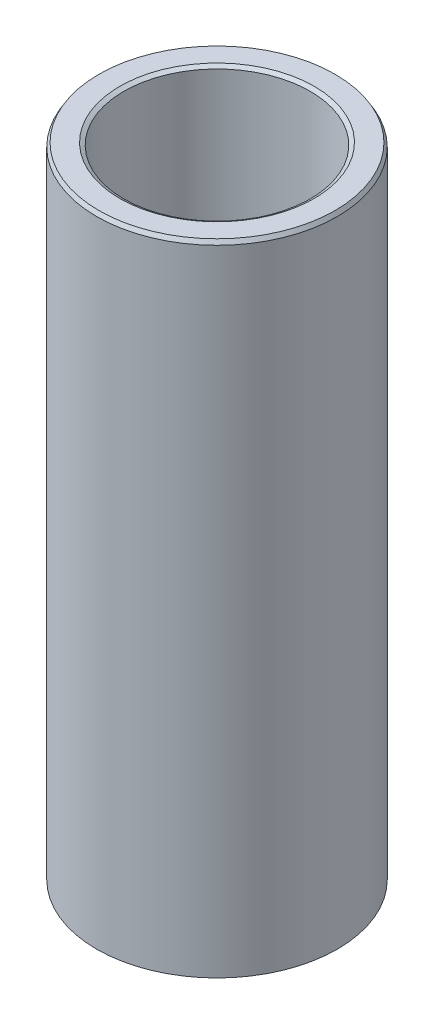
from build123d import *
from OCP.BRepFilletAPI import BRepFilletAPI_MakeChamfer

# Parameters (mm, degrees)
SKETCH1_R           = 15
BOSS_EXTRUDE1_DEPTH = 79.845970197
SKETCH2_R           = 11.615257821
CUT_EXTRUDE1_DEPTH  = 83.615851728
CHAMFER1_SIZE       = 0.49858104
CHAMFER1_SIZE2      = 0.290204487


with BuildPart() as part:
    # Sketch1 → Boss-Extrude1 (new body)
    with BuildSketch(Plane(origin=(0, 0, 0), x_dir=(1, 0, 0), z_dir=(0, 1, 0))):
        Circle(SKETCH1_R)
    extrude(amount=BOSS_EXTRUDE1_DEPTH)

    # Sketch2 → Cut-Extrude1 (cut, through all)
    with BuildSketch(Plane(origin=(0, 0, 0), x_dir=(1, 0, 0), z_dir=(0, 1, 0))):
        Circle(SKETCH2_R)
    extrude(amount=CUT_EXTRUDE1_DEPTH, mode=Mode.SUBTRACT)

    # Chamfer1: one chamfer whose edges measure the first distance from different faces: ONE call of the kernel's chamfer builder (chamfer() names one face for all edges)
    chamfer1_edges_1 = [part.edges().sort_by_distance(p)[0] for p in [
        (-11.615257821, 79.845970197, 0),
    ]]
    chamfer1_side_1 = [part.faces().sort_by_distance(p)[0] for p in [
        (-14.575735931, 79.845970197, 0),
    ]]
    chamfer1_edges_2 = [part.edges().sort_by_distance(p)[0] for p in [
        (-11.615257821, 0, 0),
    ]]
    chamfer1_side_2 = [part.faces().sort_by_distance(p)[0] for p in [
        (-11.615257821, 39.922985099, 0),
    ]]
    chamfer1_edges_3 = [part.edges().sort_by_distance(p)[0] for p in [
        (-15, 0, 0),
    ]]
    chamfer1_side_3 = [part.faces().sort_by_distance(p)[0] for p in [
        (-14.575735931, 0, 0),
    ]]
    chamfer1_edges_4 = [part.edges().sort_by_distance(p)[0] for p in [
        (-15, 79.845970197, 0),
    ]]
    chamfer1_side_4 = [part.faces().sort_by_distance(p)[0] for p in [
        (-15, 39.922985099, 0),
    ]]
    chamfer1 = BRepFilletAPI_MakeChamfer(part.part.solid().wrapped)
    for e in chamfer1_edges_1:
        chamfer1.Add(CHAMFER1_SIZE, CHAMFER1_SIZE2, e.wrapped, chamfer1_side_1[0].wrapped)  # the first distance lies on this face
    for e in chamfer1_edges_2:
        chamfer1.Add(CHAMFER1_SIZE, CHAMFER1_SIZE2, e.wrapped, chamfer1_side_2[0].wrapped)  # the first distance lies on this face
    for e in chamfer1_edges_3:
        chamfer1.Add(CHAMFER1_SIZE, CHAMFER1_SIZE2, e.wrapped, chamfer1_side_3[0].wrapped)  # the first distance lies on this face
    for e in chamfer1_edges_4:
        chamfer1.Add(CHAMFER1_SIZE, CHAMFER1_SIZE2, e.wrapped, chamfer1_side_4[0].wrapped)  # the first distance lies on this face
    add(Compound.cast(chamfer1.Shape()), mode=Mode.REPLACE)


solid = part.part
